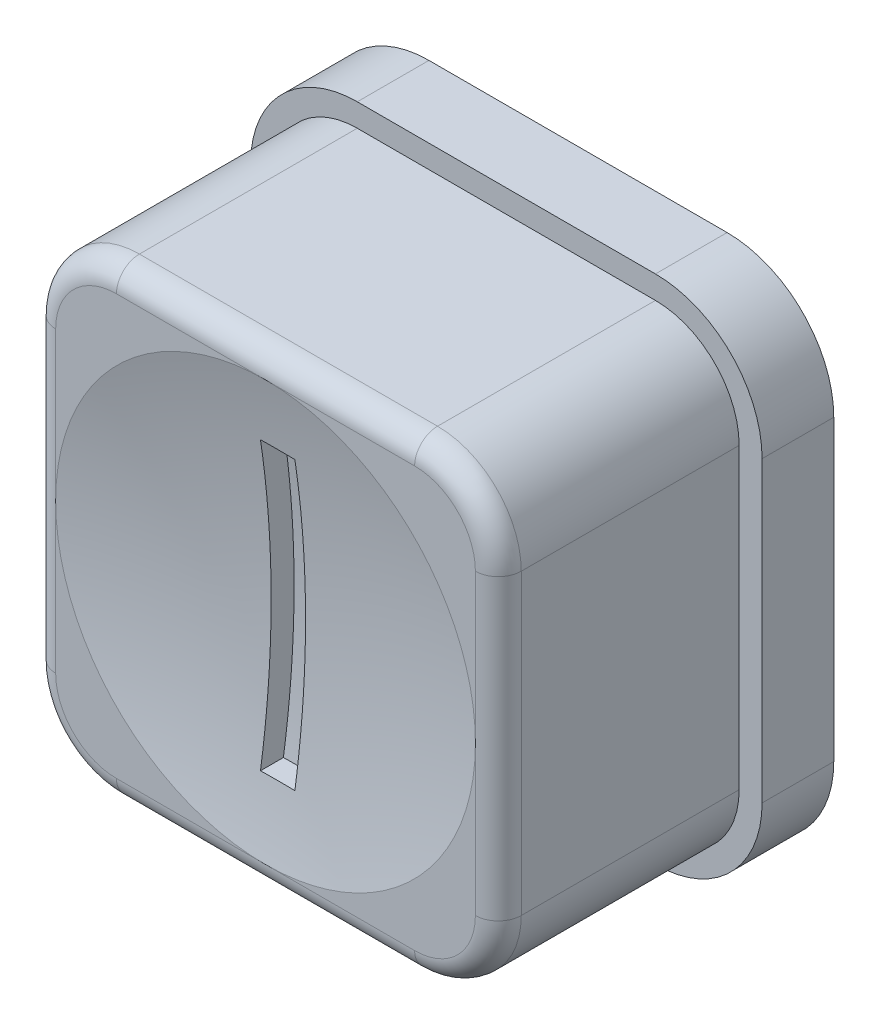
from build123d import *

# Parameters (mm, degrees)
BOSS_EXTRUDE1_DEPTH              = 5.334
FILLET1_R                        = 0.508
BOSS_EXTRUDE2_DEPTH              = 1.5875
F_56_0_0465_DIAMETER_HOLE1_D     = 1.1811
F_56_0_0465_DIAMETER_HOLE1_DEPTH = 5.08
CUT_EXTRUDE3_REACH               = 13.094
CUT_EXTRUDE3_START_RADIUS        = 21.519514579
CUT_EXTRUDE3_END_RADIUS          = 21.519514579
SKETCH9_W                        = 0.762
SKETCH9_H                        = 6.35


with BuildPart() as part:
    # Sketch1 → Boss-Extrude1 (new body)
    with BuildSketch(Plane.XY):
        with BuildLine():
            Line((3.301999954, 5.156199954), (-3.301999954, 5.156199954))
            ThreePointArc((-3.301999954, 5.156199954), (-4.613117348, 4.613117348), (-5.156199954, 3.301999954))
            Line((-5.156199954, 3.301999954), (-5.156199954, -3.301999954))
            ThreePointArc((-5.156199954, -3.301999954), (-4.613117348, -4.613117348), (-3.301999954, -5.156199954))
            Line((-3.301999954, -5.156199954), (3.301999954, -5.156199954))
            ThreePointArc((3.301999954, -5.156199954), (4.613117348, -4.613117348), (5.156199954, -3.301999954))
            Line((5.156199954, -3.301999954), (5.156199954, 3.301999954))
            ThreePointArc((5.156199954, 3.301999954), (4.613117348, 4.613117348), (3.301999954, 5.156199954))
        make_face()
    extrude(amount=-BOSS_EXTRUDE1_DEPTH)

    # Fillet1
    fillet1_edges = [part.edges().sort_by_distance(p)[0] for p in [
        (5.156199954, 0, 0),
        (4.613117348, -4.613117348, 0),
        (0, -5.156199954, 0),
        (-4.613117348, -4.613117348, 0),
        (-5.156199954, 0, 0),
        (-4.613117348, 4.613117348, 0),
        (0, 5.156199954, 0),
        (4.613117348, 4.613117348, 0),
    ]]
    fillet(fillet1_edges, radius=FILLET1_R)

    # Sketch4 → Boss-Extrude2 (add)
    with BuildSketch(Plane(origin=(0, 0, -5.334), x_dir=(-1, 0, 0), z_dir=(0, 0, -1))):
        with BuildLine():
            Line((-5.664199954, 3.301999954), (-5.664199954, -3.301999954))
            ThreePointArc((-5.664199954, -3.301999954), (-4.972327592, -4.972327592), (-3.301999954, -5.664199954))
            Line((-3.301999954, -5.664199954), (3.301999954, -5.664199954))
            ThreePointArc((3.301999954, -5.664199954), (4.972327592, -4.972327592), (5.664199954, -3.301999954))
            Line((5.664199954, -3.301999954), (5.664199954, 3.301999954))
            ThreePointArc((5.664199954, 3.301999954), (4.972327592, 4.972327592), (3.301999954, 5.664199954))
            Line((3.301999954, 5.664199954), (-3.301999954, 5.664199954))
            ThreePointArc((-3.301999954, 5.664199954), (-4.972327592, 4.972327592), (-5.664199954, 3.301999954))
        make_face()
    extrude(amount=BOSS_EXTRUDE2_DEPTH)

    # #56 (0.0465) Diameter Hole1
    with Locations(Plane(origin=(0, 0, -6.9215), x_dir=(-1, 0, 0), z_dir=(0, 0, -1))):
        with Locations((0, 0)):
            Hole(F_56_0_0465_DIAMETER_HOLE1_D / 2, depth=F_56_0_0465_DIAMETER_HOLE1_DEPTH)

    # Sketch8 → Cut-Revolve1 (revolve, cut)
    with BuildSketch(Plane(origin=(0, 0, 0), x_dir=(0, 0, -1), z_dir=(1, 0, 0))):
        with BuildLine():
            Line((0, 4.648199954), (0, 0))
            Line((0, 0), (0.508, 0))
            ThreePointArc((0.508, 0), (0.380623019, 2.337938558), (0, 4.648199954))
        make_face()
    revolve(axis=Axis((0, 0, -0.508), (0, 0, 1)), mode=Mode.SUBTRACT)

    # Cut-Extrude3: from a sphere face, 13.094 long prism both ways, kept between that surface and its translate by the depth
    cut_extrude3_start = Location((0, 0, 21.011514579)) * Sphere(CUT_EXTRUDE3_START_RADIUS, mode=Mode.PRIVATE)
    cut_extrude3_end = Location((0, 0, 20.503514579)) * Sphere(CUT_EXTRUDE3_END_RADIUS, mode=Mode.PRIVATE)
    # Sketch9 → Cut-Extrude3 (cut, from a surface)
    with BuildSketch(Plane.XY, mode=Mode.PRIVATE) as cut_extrude3_sk1:
        Rectangle(SKETCH9_W, SKETCH9_H)
    cut_extrude3_tool1 = extrude(cut_extrude3_sk1.sketch, amount=CUT_EXTRUDE3_REACH, both=True, mode=Mode.PRIVATE)
    add(((cut_extrude3_tool1 - cut_extrude3_start) & cut_extrude3_end).solids().sort_by_distance((0, 0, 0))[0], mode=Mode.SUBTRACT)


solid = part.part
